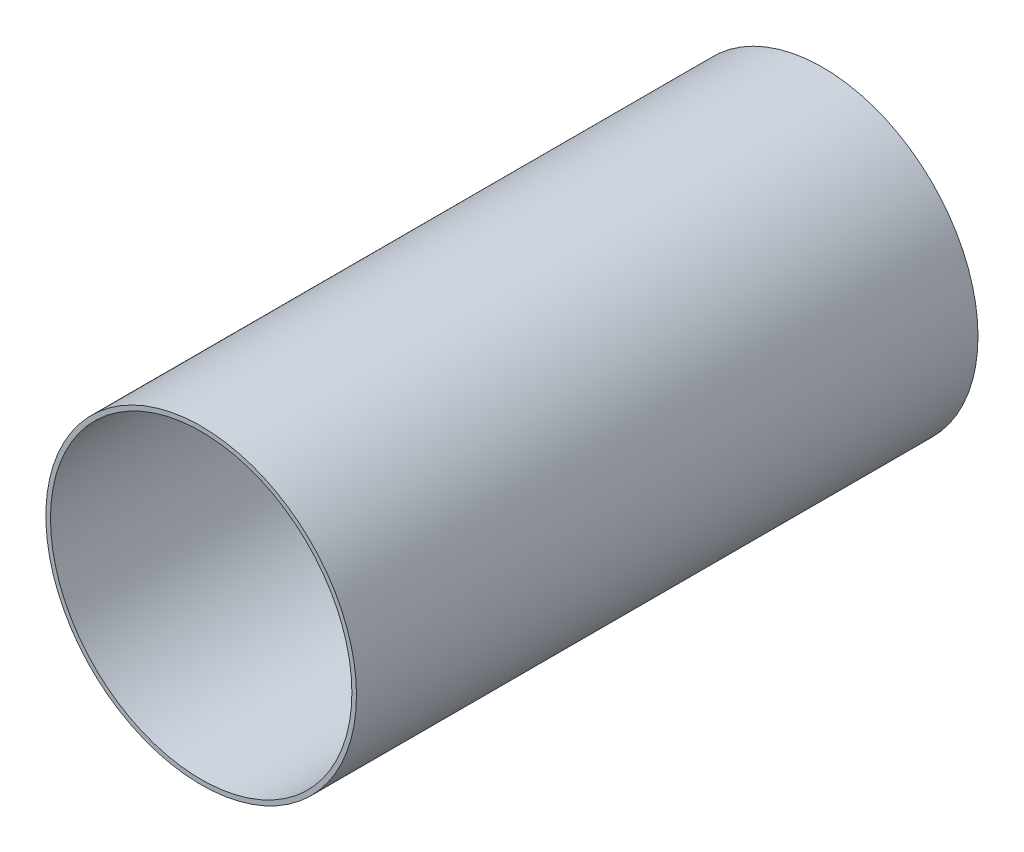
from build123d import *

# Parameters (mm, degrees)
SKETCH1_R           = 63.4746
SKETCH1_R_2         = 61.595
BOSS_EXTRUDE1_DEPTH = 127


with BuildPart() as part:
    # Sketch1 → Boss-Extrude1 (new, symmetric)
    with BuildSketch(Plane.XY):
        Circle(SKETCH1_R)
        Circle(SKETCH1_R_2, mode=Mode.SUBTRACT)
    extrude(amount=BOSS_EXTRUDE1_DEPTH, both=True)


solid = part.part
